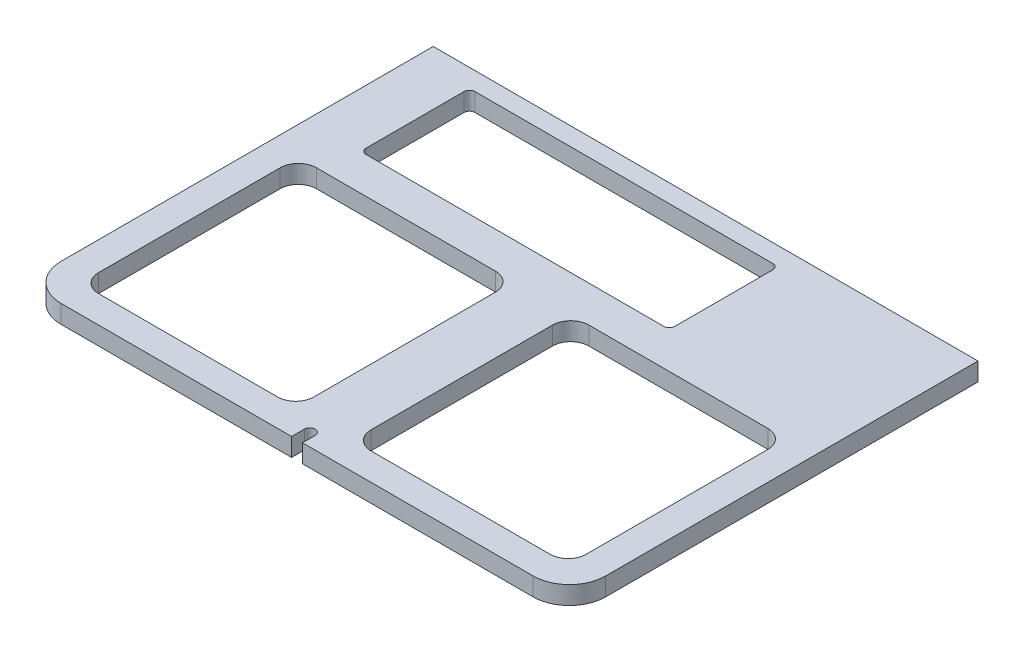
from build123d import *

# Parameters (mm, degrees)
SKIZZE1_W                       = 118.594243104
SKIZZE1_H                       = 120
LINEAR_AUSTRAGEN1_DEPTH         = 10
VERRUNDUNG2_R                   = 10
VERRUNDUNG2_OF_SPIEGELN1_R      = 10
SKIZZE3_W                       = 170
SKIZZE3_H                       = 60
SCHNITT_LINEAR_AUSTRAGEN1_DEPTH = 10
VERRUNDUNG3_R                   = 3
SCHNITT_LINEAR_AUSTRAGEN2_DEPTH = 10


with BuildPart() as part:
    # Skizze1 → Linear austragen1 (new body)
    with BuildSketch(Plane(origin=(0, 10, 0), x_dir=(1, 0, 0), z_dir=(0, 1, 0))):
        with BuildLine():
            Line((0, -75), (130, -75))
            ThreePointArc((130, -75), (144.142135624, -69.142135624), (150, -55))
            Line((150, -55), (150, 75.702878448))
            Line((150, 75.702878448), (150, 150))
            Line((150, 150), (0, 150))
            Line((0, 150), (0, 75.702878448))
            Line((0, 75.702878448), (0, -75))
        make_face()
        with Locations((75, 0)):
            Rectangle(SKIZZE1_W, SKIZZE1_H, mode=Mode.SUBTRACT)
    linear_austragen1 = extrude(amount=LINEAR_AUSTRAGEN1_DEPTH)

    # Verrundung2
    verrundung2_edges = [part.edges().sort_by_distance(p)[0] for p in [
        (15.702878448, 15, 60),
        (134.297121552, 15, 60),
        (134.297121552, 15, -60),
        (15.702878448, 15, -60),
    ]]
    fillet(verrundung2_edges, radius=VERRUNDUNG2_R)

    # Spiegeln1: Linear austragen1 across plane
    add(linear_austragen1.mirror(Plane(origin=(0, 20, -150), x_dir=(0, 0, 1), z_dir=(1, 0, 0))))

    # Verrundung2 of Spiegeln1
    verrundung2_of_spiegeln1_edges = [part.edges().sort_by_distance(p)[0] for p in [
        (-15.702878448, 15, 60),
        (-134.297121552, 15, 60),
        (-134.297121552, 15, -60),
        (-15.702878448, 15, -60),
    ]]
    fillet(verrundung2_of_spiegeln1_edges, radius=VERRUNDUNG2_OF_SPIEGELN1_R)

    # Skizze3 → Schnitt-Linear austragen1 (cut)
    with BuildSketch(Plane.XZ.offset(-10)):
        with Locations((-35, -110)):
            Rectangle(SKIZZE3_W, SKIZZE3_H)
    extrude(amount=-SCHNITT_LINEAR_AUSTRAGEN1_DEPTH, mode=Mode.SUBTRACT)

    # Verrundung3
    verrundung3_edges = [part.edges().sort_by_distance(p)[0] for p in [
        (-120, 15, -140),
        (50, 15, -140),
        (50, 15, -80),
        (-120, 15, -80),
    ]]
    fillet(verrundung3_edges, radius=VERRUNDUNG3_R)

    # Skizze4 → Schnitt-Linear austragen2 (cut)
    with BuildSketch(Plane.XZ.offset(-10)):
        with BuildLine():
            Line((-3.000050853, 75), (-3.000050853, 68))
            ThreePointArc((-3.000050853, 68), (0.008683003, 65.000012713), (2.999898294, 68.017467638))
            Line((2.999898294, 68.017467638), (2.959241489, 75))
            Line((2.959241489, 75), (-3.000050853, 75))
        make_face()
    extrude(amount=-SCHNITT_LINEAR_AUSTRAGEN2_DEPTH, mode=Mode.SUBTRACT)


solid = part.part
